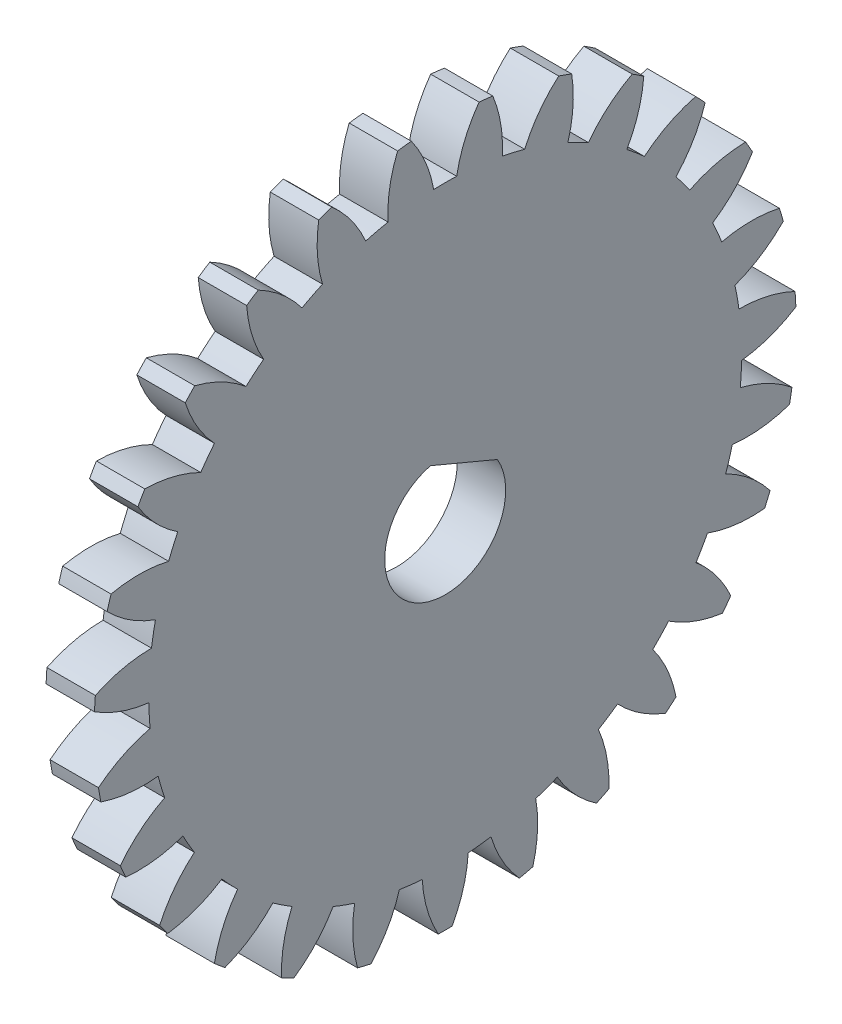
from build123d import *

# Parameters (mm, degrees)
BASPROSKE_W     = 2
BASPROSKE_H     = 14.5
TOOTHCUT_DEPTH  = 21.603397778
TEETHCUTS_COUNT = 27
TEETHCUTS_ANGLE = 346.666666667
BORE_DEPTH      = 50.0000508


with BuildPart() as part:
    # BasProSke → Base-Revolve (revolve)
    with BuildSketch(Plane(origin=(0, 0, 0), x_dir=(1, 0, 0), z_dir=(0, 1, 0))):
        with Locations((1, 7.25)):
            Rectangle(BASPROSKE_W, BASPROSKE_H)
    revolve(axis=Axis((-10, 0, 0), (1, 0, 0)))

    # TooCutSke → ToothCut (cut, through all)
    with BuildSketch(Plane(origin=(0, 0, 0), x_dir=(0, 0, -1), z_dir=(1, 0, 0))):
        with BuildLine():
            ThreePointArc((0.474054864, 12.239823242), (0, 12.249), (-0.474054864, 12.239823242))
            ThreePointArc((-0.474054864, 12.239823242), (-0.820231692, 13.40120918), (-1.416685779, 14.456149092))
            ThreePointArc((-1.416685779, 14.456149092), (0, 14.5254), (1.416685779, 14.456149092))
            ThreePointArc((1.416685779, 14.456149092), (0.820231692, 13.40120918), (0.474054864, 12.239823242))
        make_face()
    toothcut = extrude(amount=TOOTHCUT_DEPTH, mode=Mode.SUBTRACT)

    # TeethCuts: ToothCut ×27 about axis
    teethcuts_axis = Axis((-10, 0, 0), (1, 0, 0))
    for i in range(1, TEETHCUTS_COUNT):
        add(toothcut.rotate(teethcuts_axis, i * TEETHCUTS_ANGLE / (TEETHCUTS_COUNT - 1)), mode=Mode.SUBTRACT)

    # BorSke → Bore (cut, symmetric)
    with BuildSketch(Plane(origin=(0, 0, 0), x_dir=(0, 0, -1), z_dir=(1, 0, 0))):
        with BuildLine():
            Line((2.156233357, 1.265171021), (-0.61081884, 2.424231908))
            ThreePointArc((-0.61081884, 2.424231908), (-0.965884073, -2.305876831), (2.156233357, 1.265171021))
        make_face()
    extrude(amount=BORE_DEPTH, both=True, mode=Mode.SUBTRACT)


solid = part.part
